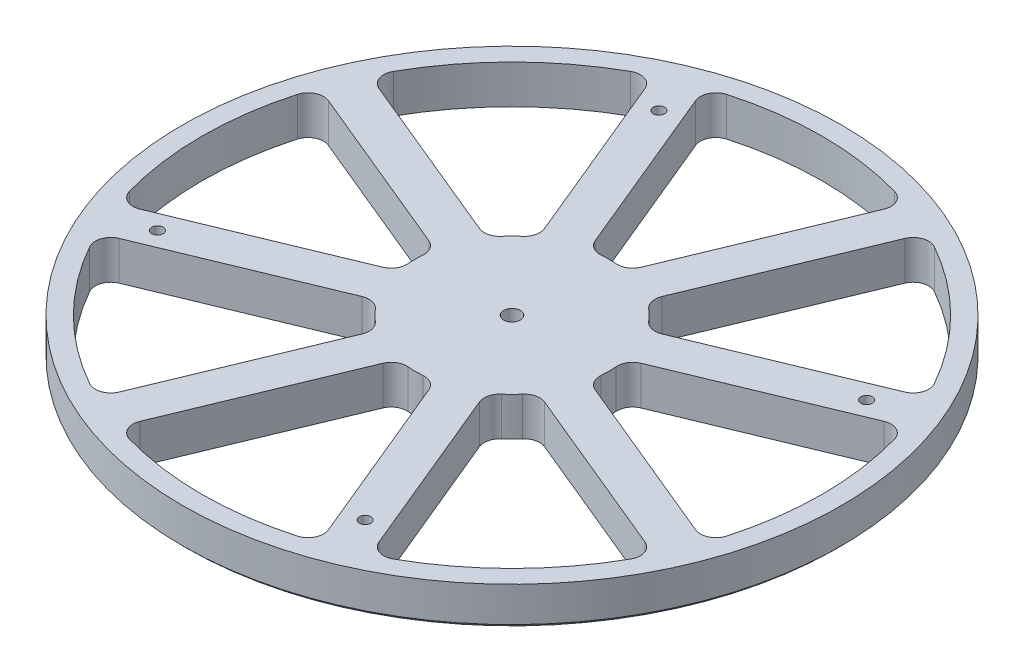
from build123d import *

# Parameters (mm, degrees)
SKETCH2_W                    = 84.99983
SKETCH2_H                    = 10
F_32_0_116_DIAMETER_HOLE1_D  = 2.9464
CIRPATTERN3_COUNT            = 4
CUT_EXTRUDE1_DEPTH           = 121.623141229
FILLET1_R                    = 4
CIRPATTERN4_COUNT            = 8
FILLET1_OF_CIRPATTERN4_R     = 4
CHAMFER2_SIZE                = 1
F_18_0_1695_DIAMETER_HOLE1_D = 4.3053


with BuildPart() as part:
    # Sketch2 → Revolve1 (revolve)
    with BuildSketch(Plane(origin=(0, 0, 0), x_dir=(0, 0, -1), z_dir=(1, 0, 0))):
        with Locations((-42.499915, 5)):
            Rectangle(SKETCH2_W, SKETCH2_H)
    revolve(axis=Axis((0, -0.75, 0), (0, 1, 0)))

    # #32 (0.116) Diameter Hole1 (through all)
    with Locations(Plane(origin=(0, 10, 0), x_dir=(1, 0, 0), z_dir=(0, 1, 0))):
        with Locations((-26.787840266, 64.671567276)):
            f_32_0_116_diameter_hole1 = Hole(F_32_0_116_DIAMETER_HOLE1_D / 2)

    # CirPattern3: #32 (0.116) Diameter Hole1 ×4 about axis
    cirpattern3_axis = Axis((0, -0.75, 0), (0, 1, 0))
    for i in range(1, CIRPATTERN3_COUNT):
        add(f_32_0_116_diameter_hole1.rotate(cirpattern3_axis, i * 360 / CIRPATTERN3_COUNT), mode=Mode.SUBTRACT)

    # Sketch8 → Cut-Extrude1 (cut, through all)
    with BuildSketch(Plane(origin=(0, 10, 0), x_dir=(1, 0, 0), z_dir=(0, 1, 0))):
        with BuildLine():
            Line((-4.754393761, 24.543751546), (-25.93535895, 75.67912497))
            ThreePointArc((-25.93535895, 75.67912497), (0, 79.99983), (25.93535895, 75.67912497))
            Line((25.93535895, 75.67912497), (4.754393761, 24.543751546))
            ThreePointArc((4.754393761, 24.543751546), (0, 25), (-4.754393761, 24.543751546))
        make_face()
    cut_extrude1 = extrude(amount=-CUT_EXTRUDE1_DEPTH, mode=Mode.SUBTRACT)

    # Fillet1
    fillet1_edges = [part.edges().sort_by_distance(p)[0] for p in [
        (4.754393761, 5, -24.543751546),
        (25.93535895, 5, -75.67912497),
        (-4.754393761, 5, -24.543751546),
        (-25.93535895, 5, -75.67912497),
    ]]
    fillet(fillet1_edges, radius=FILLET1_R)

    # CirPattern4: Cut-Extrude1 ×8 about axis
    cirpattern4_axis = Axis((0, -0.75, 0), (0, 1, 0))
    for i in range(1, CIRPATTERN4_COUNT):
        add(cut_extrude1.rotate(cirpattern4_axis, i * 360 / CIRPATTERN4_COUNT), mode=Mode.SUBTRACT)

    # Fillet1 of CirPattern4
    fillet1_of_cirpattern4_edges = [part.edges().sort_by_distance(p)[0] for p in [
        (-13.993189086, 5, -20.716917223),
        (-35.174154275, 5, -71.852290646),
        (-20.716917223, 5, -13.993189086),
        (-71.852290646, 5, -35.174154275),
        (-24.543751546, 5, -4.754393761),
        (-75.67912497, 5, -25.93535895),
        (-24.543751546, 5, 4.754393761),
        (-75.67912497, 5, 25.93535895),
        (-20.716917223, 5, 13.993189086),
        (-71.852290646, 5, 35.174154275),
        (-13.993189086, 5, 20.716917223),
        (-35.174154275, 5, 71.852290646),
        (-4.754393761, 5, 24.543751546),
        (-25.93535895, 5, 75.67912497),
        (4.754393761, 5, 24.543751546),
        (25.93535895, 5, 75.67912497),
        (13.993189086, 5, 20.716917223),
        (35.174154275, 5, 71.852290646),
        (20.716917223, 5, 13.993189086),
        (71.852290646, 5, 35.174154275),
        (24.543751546, 5, 4.754393761),
        (75.67912497, 5, 25.93535895),
        (24.543751546, 5, -4.754393761),
        (75.67912497, 5, -25.93535895),
        (20.716917223, 5, -13.993189086),
        (71.852290646, 5, -35.174154275),
        (13.993189086, 5, -20.716917223),
        (35.174154275, 5, -71.852290646),
    ]]
    fillet(fillet1_of_cirpattern4_edges, radius=FILLET1_OF_CIRPATTERN4_R)

    # Chamfer2
    chamfer2_edges = [part.edges().sort_by_distance(p)[0] for p in [
        (0, 0, -84.99983),
    ]]
    chamfer(chamfer2_edges, length=CHAMFER2_SIZE)

    # #18 (0.1695) Diameter Hole1 (through all)
    with Locations(Plane(origin=(0, 0, 0), x_dir=(-1, 0, 0), z_dir=(0, -1, 0))):
        with Locations((0, 0)):
            Hole(F_18_0_1695_DIAMETER_HOLE1_D / 2)


solid = part.part
